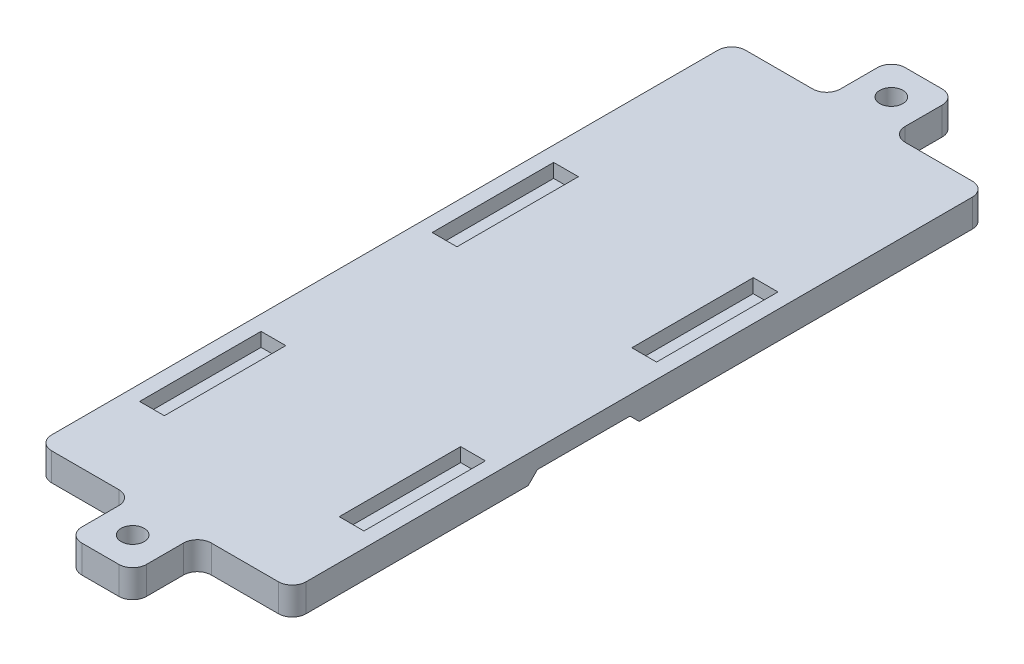
from build123d import *

# Parameters (mm, degrees)
SKIZZE1_R                       = 2.5
AUFSATZ_LINEAR_AUSTRAGEN1_DEPTH = 6
SKIZZE2_W                       = 5.35
SKIZZE2_H                       = 26.25
SCHNITT_LINEAR_AUSTRAGEN1_DEPTH = 3
SKIZZE3_W                       = 55
SKIZZE3_H                       = 20
SCHNITT_LINEAR_AUSTRAGEN2_DEPTH = 2
VERRUNDUNG1_R                   = 3
FASE1_SIZE                      = 2


with BuildPart() as part:
    # Skizze1 → Aufsatz-Linear austragen1 (new body)
    with BuildSketch(Plane(origin=(0, 0, 0), x_dir=(1, 0, 0), z_dir=(0, 1, 0))):
        Polygon((-27.5, -75), (-27.5, 75), (-7, 75), (-7, 89), (7, 89), (7, 75), (27.5, 75), (27.5, -75), (7, -75), (7, -89), (-7, -89), (-7, -75), align=None)
        with Locations(Location((0, 82, 0), (0, 0, 270))):
            Circle(SKIZZE1_R, mode=Mode.SUBTRACT)
        with Locations(Location((0, -82, 0), (0, 0, 90))):
            Circle(SKIZZE1_R, mode=Mode.SUBTRACT)
    extrude(amount=AUFSATZ_LINEAR_AUSTRAGEN1_DEPTH)

    # Skizze2 → Schnitt-Linear austragen1 (cut)
    with BuildSketch(Plane(origin=(0, 6, 0), x_dir=(1, 0, 0), z_dir=(0, 1, 0))):
        with Locations((-21.575, 20.125)):
            Rectangle(SKIZZE2_W, SKIZZE2_H)
        with Locations((21.575, 20.125)):
            Rectangle(SKIZZE2_W, SKIZZE2_H)
        with Locations((-21.575, -43.125)):
            Rectangle(SKIZZE2_W, SKIZZE2_H)
        with Locations((21.575, -43.125)):
            Rectangle(SKIZZE2_W, SKIZZE2_H)
    extrude(amount=-SCHNITT_LINEAR_AUSTRAGEN1_DEPTH, mode=Mode.SUBTRACT)

    # Skizze3 → Schnitt-Linear austragen2 (cut)
    with BuildSketch(Plane.XZ):
        with Locations((0, 12)):
            Rectangle(SKIZZE3_W, SKIZZE3_H)
    extrude(amount=-SCHNITT_LINEAR_AUSTRAGEN2_DEPTH, mode=Mode.SUBTRACT)

    # Verrundung1
    verrundung1_edges = [part.edges().sort_by_distance(p)[0] for p in [
        (-7, 3, -75),
        (-7, 3, -89),
        (7, 3, -89),
        (7, 3, -75),
        (27.5, 3, -75),
        (27.5, 3, 75),
        (7, 3, 75),
        (7, 3, 89),
        (-7, 3, 89),
        (-7, 3, 75),
        (-27.5, 3, 75),
        (-27.5, 3, -75),
    ]]
    fillet(verrundung1_edges, radius=VERRUNDUNG1_R)

    # Fase1
    fase1_edges = [part.edges().sort_by_distance(p)[0] for p in [
        (0, 0, 22),
        (0, 0, 2),
    ]]
    chamfer(fase1_edges, length=FASE1_SIZE - 0.0001)  # a hair under: the kernel refuses the full size


solid = part.part
